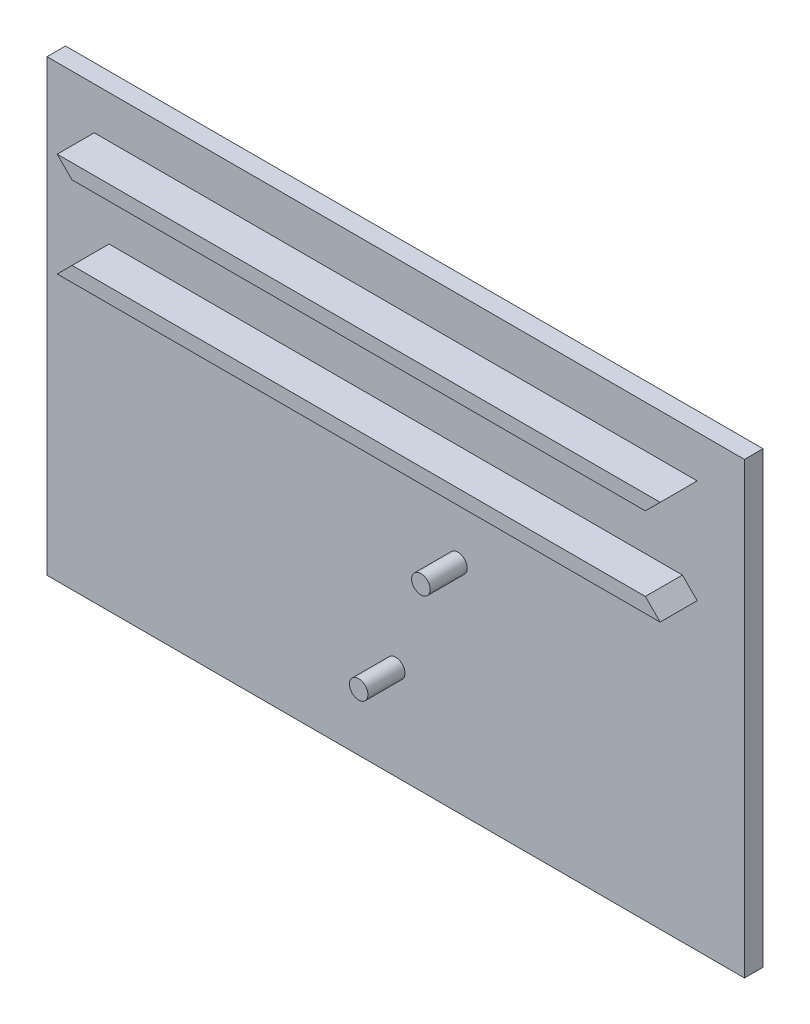
from build123d import *

# Parameters (mm, degrees)
BOSS_EXTRUDE1_DEPTH   = 12.7
BOSS_EXTRUDE1_2_DEPTH = 12.7
SKETCH2_R             = 3.175
BOSS_EXTRUDE1_3_DEPTH = 12.7
BOSS_EXTRUDE1_4_DEPTH = 12.7
SKETCH2_3_W           = 239.064376672
SKETCH2_3_H           = 153.94029831
BOSS_EXTRUDE2_DEPTH   = 6.35


with BuildPart() as part:
    # Sketch2 → Boss-Extrude1 (new body)
    with BuildSketch(Plane.XY):
        Polygon((-103.331182916, 107.188), (-98.251182916, 102.108), (98.251182916, 102.108), (103.331182916, 107.188), align=None)
    extrude(amount=BOSS_EXTRUDE1_DEPTH)



with BuildPart() as body_2:
    # Sketch2 → Boss-Extrude1 2 (new body)
    with BuildSketch(Plane.XY):
        Polygon((103.331182916, 71.628), (98.251182916, 76.708), (-98.251182916, 76.708), (-103.331182916, 71.628), align=None)
    extrude(amount=BOSS_EXTRUDE1_2_DEPTH)


with BuildPart() as body_3:
    # Sketch2 → Boss-Extrude1 3 (new body)
    with BuildSketch(Plane.XY):
        Circle(SKETCH2_R)
    extrude(amount=BOSS_EXTRUDE1_3_DEPTH)


with BuildPart() as body_4:
    # Sketch2 → Boss-Extrude1 4 (new body)
    with BuildSketch(Plane.XY):
        with Locations((21.333013583, 41.868396572)):
            Circle(SKETCH2_R)
    extrude(amount=BOSS_EXTRUDE1_4_DEPTH)


with BuildPart() as part_1:
    add(part.part)

    add(body_2.part)  # Boss-Extrude2 merges body 2

    add(body_3.part)  # Boss-Extrude2 merges body 3

    add(body_4.part)  # Boss-Extrude2 merges body 4
    # Sketch2<3> → Boss-Extrude2 (add)
    with BuildSketch(Plane.XY):
        with Locations((0, 44.704)):
            Rectangle(SKETCH2_3_W, SKETCH2_3_H)
    extrude(amount=-BOSS_EXTRUDE2_DEPTH)


solid = part_1.part
